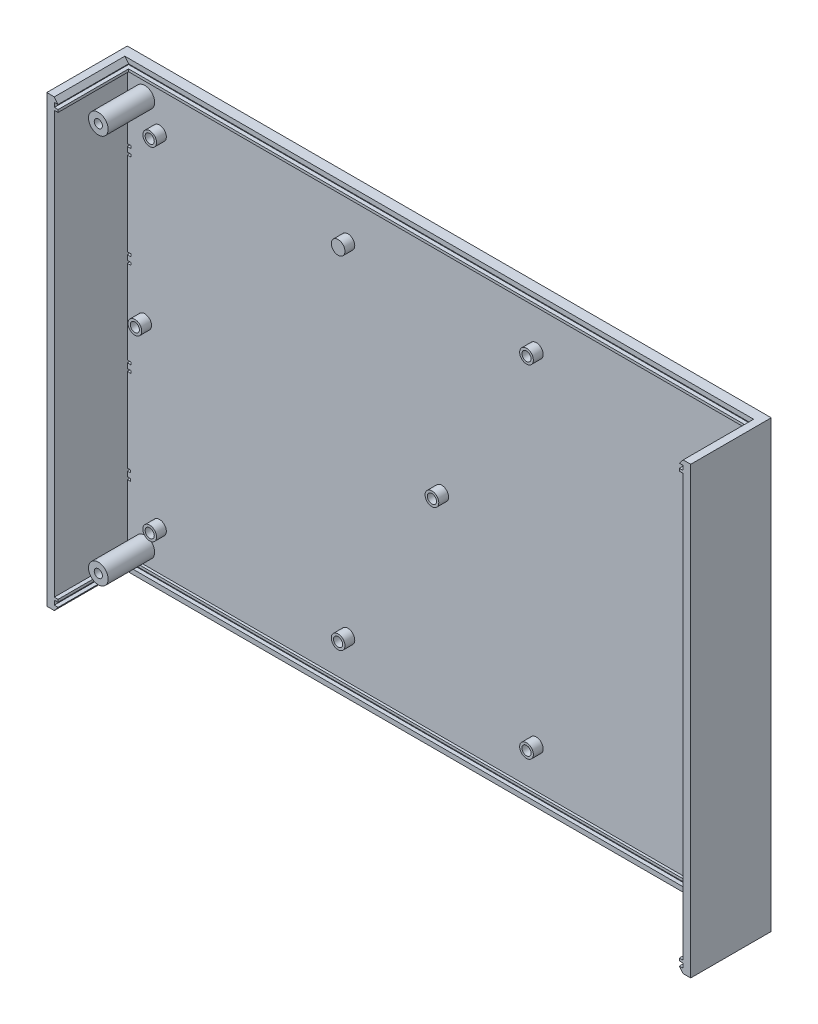
from build123d import *

# Parameters (mm, degrees)
SKETCH1_W           = 260.096
SKETCH1_H           = 179.705
SKETCH1_W_2         = 1.524
SKETCH1_H_2         = 1.016
SKETCH1_W_3         = 1.3716
SKETCH1_W_4         = 1.397
SKETCH1_R           = 1.143
BOSS_EXTRUDE1_DEPTH = 3.048
BOSS_EXTRUDE2_DEPTH = 32.5374
SKETCH1_6_R         = 2.7686
SKETCH1_6_R_2       = 1.8415
BOSS_EXTRUDE3_DEPTH = 7.0104
SKETCH1_7_W         = 250.952
SKETCH1_7_H         = 1.016
BOSS_EXTRUDE4_DEPTH = 4.064
SKETCH1_8_R         = 3.9624
SKETCH1_8_R_2       = 1.651
BOSS_EXTRUDE5_DEPTH = 21.844
SKETCH3_W           = 254
SKETCH3_H           = 1.778
CUT_EXTRUDE1_DEPTH  = 0.508


with BuildPart() as part:
    # Sketch1 → Boss-Extrude1 (new body)
    with BuildSketch(Plane.XY):
        Rectangle(SKETCH1_W, SKETCH1_H)
        with Locations((-126.238, -85.6615)):
            Rectangle(SKETCH1_W_2, SKETCH1_H_2, mode=Mode.SUBTRACT)
        with Locations((-126.3142, -58.2676)):
            Rectangle(SKETCH1_W_3, SKETCH1_H_2, mode=Mode.SUBTRACT)
        with Locations((-126.3142, -55.2704)):
            Rectangle(SKETCH1_W_3, SKETCH1_H_2, mode=Mode.SUBTRACT)
        with Locations((-126.3015, -20.4216)):
            Rectangle(SKETCH1_W_4, SKETCH1_H_2, mode=Mode.SUBTRACT)
        with Locations((-126.3015, -17.4244)):
            Rectangle(SKETCH1_W_4, SKETCH1_H_2, mode=Mode.SUBTRACT)
        with Locations((-126.3015, 17.4244)):
            Rectangle(SKETCH1_W_4, SKETCH1_H_2, mode=Mode.SUBTRACT)
        with Locations((-126.3015, 20.4216)):
            Rectangle(SKETCH1_W_4, SKETCH1_H_2, mode=Mode.SUBTRACT)
        with Locations((-126.3015, 55.2704)):
            Rectangle(SKETCH1_W_4, SKETCH1_H_2, mode=Mode.SUBTRACT)
        with Locations((-126.3015, 58.2676)):
            Rectangle(SKETCH1_W_4, SKETCH1_H_2, mode=Mode.SUBTRACT)
        with Locations((-113.9952, -68.9864)):
            Circle(SKETCH1_R, mode=Mode.SUBTRACT)
    extrude(amount=BOSS_EXTRUDE1_DEPTH)

    # Sketch1<5> → Boss-Extrude2 (add)
    with BuildSketch(Plane.XY):
        Polygon((-127, 85.1535), (-125.476, 85.1535), (-125.476, 86.1695), (-127, 86.1695), (-127, 87.9475), (-125.476, 87.9475), (-127, 89.8525), (-130.048, 89.8525), (-130.048, -89.8525), (-127, -89.8525), (-125.476, -87.9475), (-127, -87.9475), (-127, -86.1695), (-125.476, -86.1695), (-125.476, -85.1535), (-127, -85.1535), (-127, -58.7756), (-127, -57.7596), (-127, -55.7784), (-127, -54.7624), align=None)
        Polygon((125.476, 86.1695), (125.476, 85.1535), (127, 85.1535), (127, -85.1535), (125.476, -85.1535), (125.476, -86.1695), (127, -86.1695), (127, -87.9475), (125.476, -87.9475), (127, -89.8525), (130.048, -89.8525), (130.048, 89.8525), (127, 89.8525), (125.476, 87.9475), (127, 87.9475), (127, 86.1695), align=None)
    extrude(amount=BOSS_EXTRUDE2_DEPTH)

    # Sketch1<6> → Boss-Extrude3 (add)
    # profile 1 of 8: a face of its own
    with BuildSketch(Plane.XY):
        with Locations((-113.9952, -68.9864)):
            Circle(SKETCH1_6_R)
        with Locations((-113.9952, -68.9864)):
            Circle(SKETCH1_6_R_2, mode=Mode.SUBTRACT)
    # profile 2 of 8: a face of its own
    with BuildSketch(Plane.XY):
        Circle(SKETCH1_6_R)
        Circle(SKETCH1_6_R_2, mode=Mode.SUBTRACT)
    # profile 3 of 8: a face of its own
    with BuildSketch(Plane.XY):
        with Locations((-113.9952, 68.9864)):
            Circle(SKETCH1_6_R)
        with Locations((-113.9952, 68.9864)):
            Circle(SKETCH1_6_R_2, mode=Mode.SUBTRACT)
    # profile 4 of 8: a face of its own
    with BuildSketch(Plane.XY):
        with Locations((-37.8968, -68.9864)):
            Circle(SKETCH1_6_R)
        with Locations((-37.8968, -68.9864)):
            Circle(SKETCH1_6_R_2, mode=Mode.SUBTRACT)
    # profile 5 of 8: a face of its own
    with BuildSketch(Plane.XY):
        with Locations((-37.8968, 68.9864)):
            Circle(SKETCH1_6_R)
    # profile 6 of 8: a face of its own
    with BuildSketch(Plane.XY):
        with Locations((38.2016, -68.9864)):
            Circle(SKETCH1_6_R)
        with Locations((38.2016, -68.9864)):
            Circle(SKETCH1_6_R_2, mode=Mode.SUBTRACT)
    # profile 7 of 8: a face of its own
    with BuildSketch(Plane.XY):
        with Locations((38.2016, 68.9864)):
            Circle(SKETCH1_6_R)
        with Locations((38.2016, 68.9864)):
            Circle(SKETCH1_6_R_2, mode=Mode.SUBTRACT)
    # profile 8 of 8: a face of its own
    with BuildSketch(Plane.XY):
        with Locations((-119.9896, 0)):
            Circle(SKETCH1_6_R)
        with Locations((-119.9896, 0)):
            Circle(SKETCH1_6_R_2, mode=Mode.SUBTRACT)
    extrude(amount=BOSS_EXTRUDE3_DEPTH)

    # Sketch1<7> → Boss-Extrude4 (add)
    with BuildSketch(Plane.XY):
        with Locations((0, 85.6615)):
            Rectangle(SKETCH1_7_W, SKETCH1_7_H)
        Polygon((-127, 89.8525), (-125.476, 87.9475), (125.476, 87.9475), (127, 89.8525), align=None)
        with Locations((0, -85.6615)):
            Rectangle(SKETCH1_7_W, SKETCH1_7_H)
        Polygon((-125.476, -87.9475), (-127, -89.8525), (127, -89.8525), (125.476, -87.9475), align=None)
    extrude(amount=BOSS_EXTRUDE4_DEPTH)

    # Sketch1<8> → Boss-Extrude5 (add)
    # profile 1 of 2: a face of its own
    with BuildSketch(Plane.XY):
        with Locations((-119.9134, -78.6765)):
            Circle(SKETCH1_8_R)
        with Locations((-119.9134, -78.6765)):
            Circle(SKETCH1_8_R_2, mode=Mode.SUBTRACT)
    # profile 2 of 2: a face of its own
    with BuildSketch(Plane.XY):
        with Locations((-119.9134, 78.6765)):
            Circle(SKETCH1_8_R)
        with Locations((-119.9134, 78.6765)):
            Circle(SKETCH1_8_R_2, mode=Mode.SUBTRACT)
    extrude(amount=BOSS_EXTRUDE5_DEPTH)

    # Sketch3 → Cut-Extrude1 (cut)
    with BuildSketch(Plane.XY.offset(3.048)):
        with Locations((0, 87.0585)):
            Rectangle(SKETCH3_W, SKETCH3_H)
        with Locations((0, -87.0585)):
            Rectangle(SKETCH3_W, SKETCH3_H)
    extrude(amount=-CUT_EXTRUDE1_DEPTH, mode=Mode.SUBTRACT)


solid = part.part
